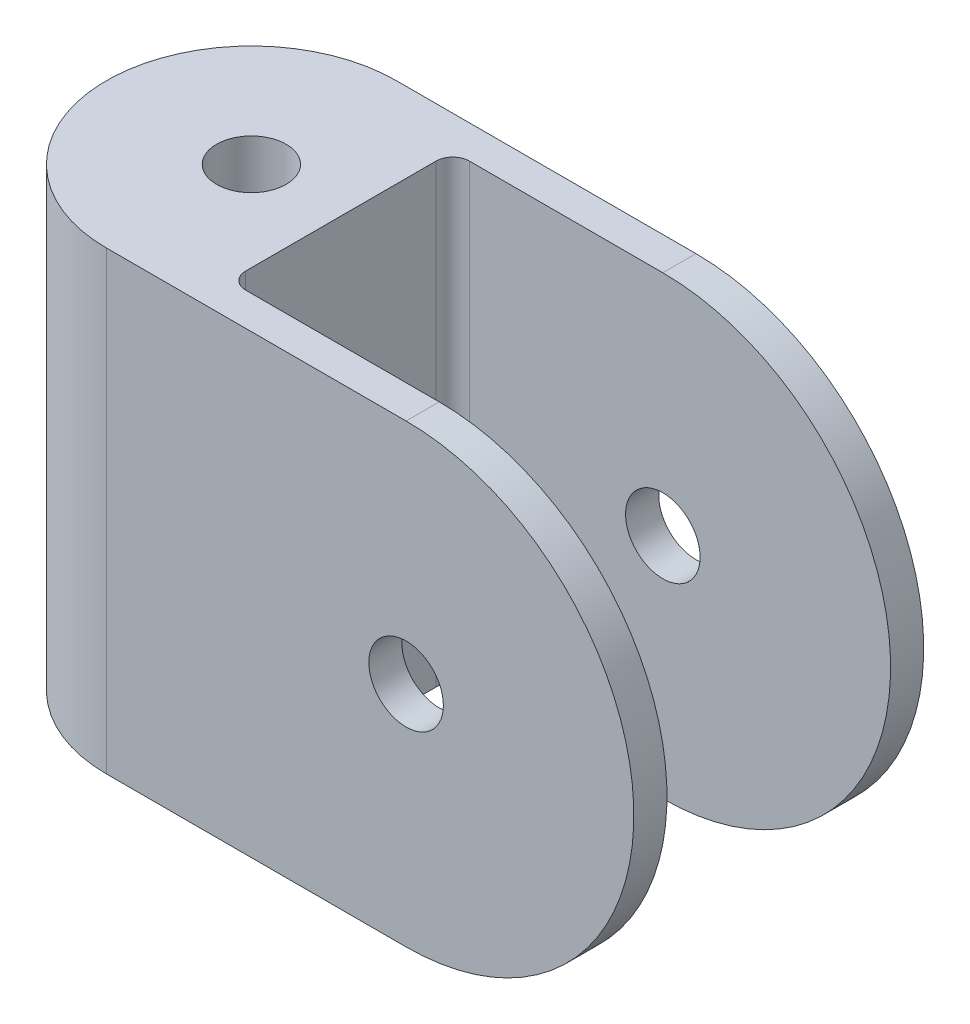
from build123d import *

# Parameters (mm, degrees)
BOSS_EXTRUDE4_START = 13.5
BOSS_EXTRUDE4_DEPTH = 4
BOSS_EXTRUDE5_START = -13.5
BOSS_EXTRUDE5_DEPTH = 4
SKETCH9_R           = 4.5
CUT_EXTRUDE6_DEPTH  = 81.661329025
SKETCH11_R          = 4.2
BOSS_EXTRUDE6_DEPTH = 55
FILLET1_R           = 2


with BuildPart() as part:
    # Sketch8 → Boss-Extrude4 (new body)
    with BuildSketch(Plane.XY.offset(BOSS_EXTRUDE4_START)):
        with BuildLine():
            Line((0, 0), (0, 55))
            Line((0, 55), (20, 55))
            ThreePointArc((20, 55), (47.5, 27.5), (20, 0))
            Line((20, 0), (0, 0))
        make_face()
    extrude(amount=BOSS_EXTRUDE4_DEPTH)


with BuildPart() as body_2:
    # Sketch8<2> → Boss-Extrude5 (new body)
    with BuildSketch(Plane.XY.offset(BOSS_EXTRUDE5_START)):
        with BuildLine():
            Line((0, 0), (0, 55))
            Line((0, 55), (20, 55))
            ThreePointArc((20, 55), (47.5, 27.5), (20, 0))
            Line((20, 0), (0, 0))
        make_face()
    extrude(amount=-BOSS_EXTRUDE5_DEPTH)


with BuildPart() as cut_extrude6_tool:
    # Sketch9 → Cut-Extrude6 (new, through all)
    with BuildSketch(Plane.XY.offset(17.5)):
        with Locations((20, 27.5)):
            Circle(SKETCH9_R)
    extrude(amount=-CUT_EXTRUDE6_DEPTH)


with BuildPart() as part_1:
    add(part.part)

    # Cut-Extrude6: cut by cut_extrude6_tool
    add(cut_extrude6_tool.part, mode=Mode.SUBTRACT)



with BuildPart() as body_2_1:
    add(body_2.part)

    # Cut-Extrude6: cut by cut_extrude6_tool
    add(cut_extrude6_tool.part, mode=Mode.SUBTRACT)


with BuildPart() as part_2:
    add(part_1.part)

    add(body_2_1.part)  # Boss-Extrude6 merges body 2
    # Sketch11 → Boss-Extrude6 (add)
    with BuildSketch(Plane(origin=(0, 55, 0), x_dir=(1, 0, 0), z_dir=(0, 1, 0))):
        with BuildLine():
            Line((0, 13.5), (-5.368090399, 13.5))
            Line((-5.368090399, 13.5), (-5.368090399, -13.5))
            Line((-5.368090399, -13.5), (0, -13.5))
            Line((0, -13.5), (0, -17.5))
            Line((0, -17.5), (-16.181282026, -17.5))
            ThreePointArc((-16.181282026, -17.5), (-33.681282026, 0), (-16.181282026, 17.5))
            Line((-16.181282026, 17.5), (0, 17.5))
            Line((0, 17.5), (0, 13.5))
        make_face()
        with Locations((-16.181282026, 0)):
            Circle(SKETCH11_R, mode=Mode.SUBTRACT)
    extrude(amount=-BOSS_EXTRUDE6_DEPTH)

    # Fillet1
    fillet1_edges = [part_2.edges().sort_by_distance(p)[0] for p in [
        (-5.368090399, 27.5, 13.5),
        (-5.368090399, 27.5, -13.5),
    ]]
    fillet(fillet1_edges, radius=FILLET1_R)


solid = part_2.part
